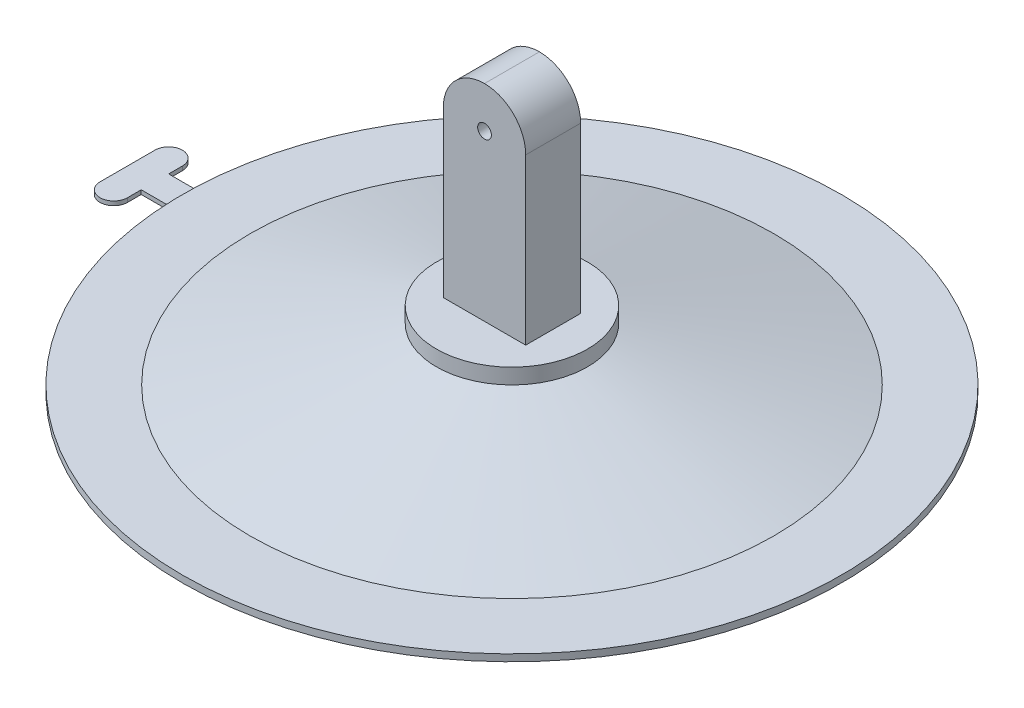
from build123d import *

# Parameters (mm, degrees)
PAD_THICKEN_T1        = 0.5
PLUNGER_PROFILE_W     = 6
PLUNGER_PROFILE_H     = 4
PLUNGER_EXTRUDE_DEPTH = 15
PLUNGER_FILLET_R      = 3
PIN_HOLE_PROFILE_R    = 0.5
PIN_HOLE_CUT_DEPTH    = 5
TAG_EXTRUDE_DEPTH     = 0.3


with BuildPart() as body_1:
    # Pad Surface Revolve: a surface, the sketch's curves turned about an axis
    with BuildLine(Plane.XY, mode=Mode.PRIVATE) as pad_surface_revolve_1_path:
        Line((-24, 0), (-19, 0))
        Line((-19, 0), (-5, 4))
        Line((-5, 4), (-5, 5))
        Line((-5, 5), (0, 5))
    pad_surface_revolve_1 = Shell.revolve(pad_surface_revolve_1_path.wire(), 360, Axis((0, 0, 0), (0, 1, 0)))
    add(Solid.thicken(pad_surface_revolve_1, PAD_THICKEN_T1))

    # Tag Profile → Tag Extrude (add)
    with BuildSketch(Plane(origin=(0, 0, 0), x_dir=(1, 0, 0), z_dir=(0, 1, 0))):
        with BuildLine():
            Line((-26, 2), (-26, 1))
            Line((-26, 1), (-23, 1))
            Line((-23, 1), (-23, -1))
            Line((-23, -1), (-26, -1))
            Line((-26, -1), (-26, -2))
            ThreePointArc((-26, -2), (-27, -3), (-28, -2))
            Line((-28, -2), (-28, 2))
            ThreePointArc((-28, 2), (-27, 3), (-26, 2))
        make_face()
    extrude(amount=TAG_EXTRUDE_DEPTH)


with BuildPart() as body_2:
    # Plunger Profile → Plunger Extrude (new body)
    with BuildSketch(Plane(origin=(0, 5.5, 0), x_dir=(1, 0, 0), z_dir=(0, 1, 0))):
        Rectangle(PLUNGER_PROFILE_W, PLUNGER_PROFILE_H)
    extrude(amount=PLUNGER_EXTRUDE_DEPTH)

    # Plunger Fillet
    plunger_fillet_edges = [body_2.edges().sort_by_distance(p)[0] for p in [
        (-3, 20.5, 0),
        (3, 20.5, 0),
    ]]
    fillet(plunger_fillet_edges, radius=PLUNGER_FILLET_R - 0.0001)  # a hair under: the kernel refuses the full size

    # Pin Hole Profile → Pin Hole Cut (cut)
    with BuildSketch(Plane(origin=(0, 0, -2), x_dir=(-1, 0, 0), z_dir=(0, 0, -1))):
        with Locations((0, 17.5)):
            Circle(PIN_HOLE_PROFILE_R)
    extrude(amount=-PIN_HOLE_CUT_DEPTH, mode=Mode.SUBTRACT)


solid = Compound([body_1.part, body_2.part])
